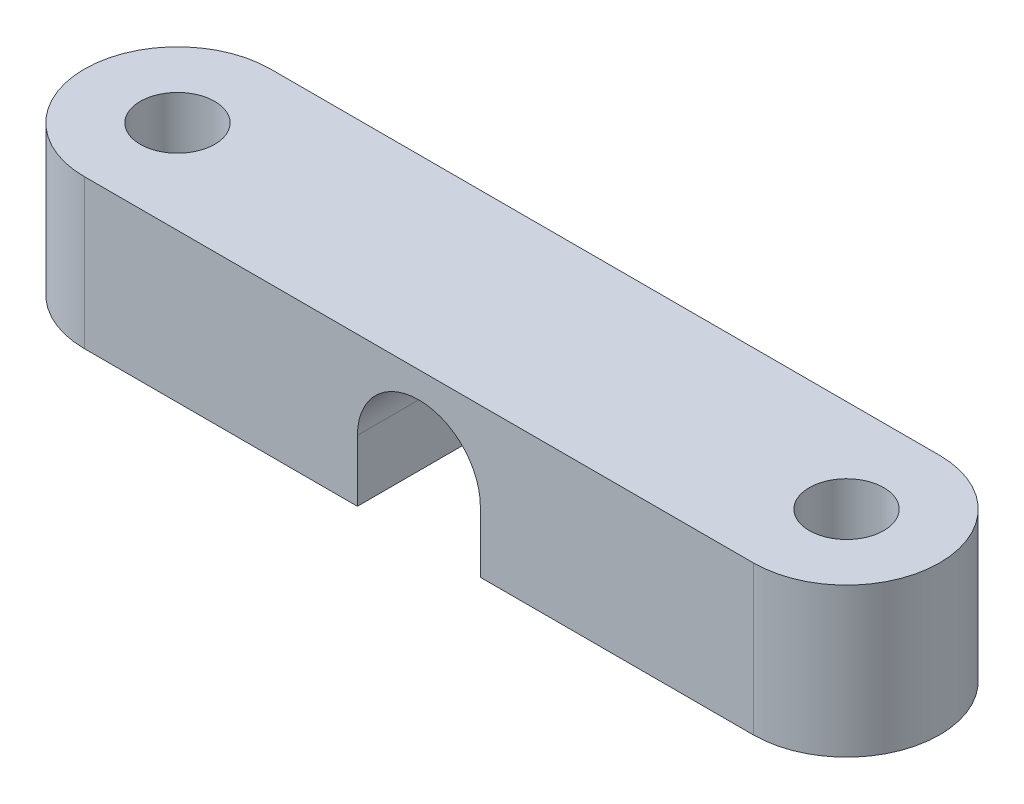
from build123d import *

# Parameters (mm, degrees)
SKETCH1_R           = 2
BOSS_EXTRUDE1_DEPTH = 8
CUT_EXTRUDE1_DEPTH  = 27.290399815


with BuildPart() as part:
    # Sketch1 → Boss-Extrude1 (new body)
    with BuildSketch(Plane(origin=(0, 0, 0), x_dir=(1, 0, 0), z_dir=(0, 1, 0))):
        with BuildLine():
            Line((-17.960512242, 22.960512242), (17.960512242, 22.960512242))
            ThreePointArc((17.960512242, 22.960512242), (22.960512242, 17.960512242), (17.960512242, 12.960512242))
            Line((17.960512242, 12.960512242), (-17.960512242, 12.960512242))
            ThreePointArc((-17.960512242, 12.960512242), (-22.960512242, 17.960512242), (-17.960512242, 22.960512242))
        make_face()
        with Locations((-17.960512242, 17.960512242)):
            Circle(SKETCH1_R, mode=Mode.SUBTRACT)
        with Locations((17.960512242, 17.960512242)):
            Circle(SKETCH1_R, mode=Mode.SUBTRACT)
    extrude(amount=BOSS_EXTRUDE1_DEPTH)

    # Sketch2 → Cut-Extrude1 (cut, through all)
    with BuildSketch(Plane.XY.offset(-12.960512242)):
        with BuildLine():
            ThreePointArc((3.3, 3.3), (0, 6.6), (-3.3, 3.3))
            Line((-3.3, 3.3), (-3.3, 0))
            Line((-3.3, 0), (3.3, 0))
            Line((3.3, 0), (3.3, 3.3))
        make_face()
    extrude(amount=-CUT_EXTRUDE1_DEPTH, mode=Mode.SUBTRACT)


solid = part.part
